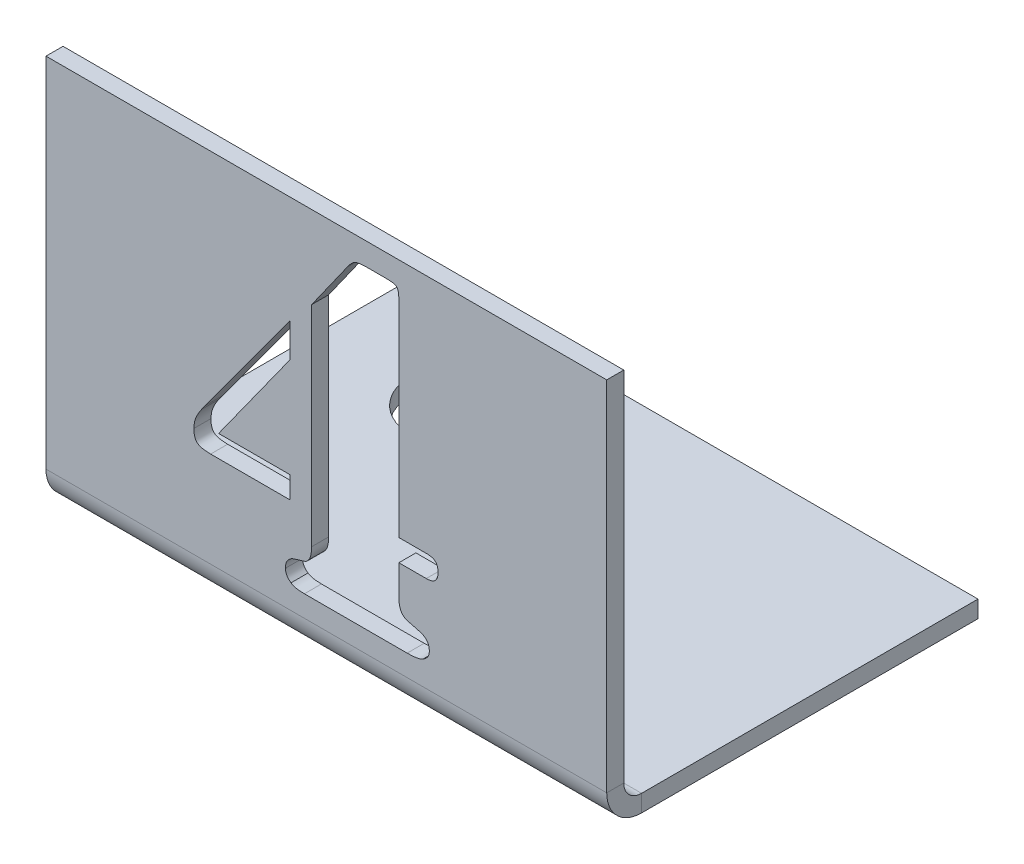
from build123d import *

# Parameters (mm, degrees)
SKETCH1_W            = 50
SKETCH1_H            = 30
BASE_FLANGE1_DEPTH   = 1.51892
EDGE_FLANGE1_DEPTH   = 50
M8_CLEARANCE_HOLE1_D = 9
CUT_EXTRUDE1_DEPTH   = 55.277389816


# Sheet-metal steps are written as plain solids
with BuildPart() as part:
    # Sketch1 → Base-Flange1 (new body)
    with BuildSketch(Plane(origin=(0, 0, 0), x_dir=(1, 0, 0), z_dir=(0, 1, 0))):
        with Locations((0, 15)):
            Rectangle(SKETCH1_W, SKETCH1_H)
    extrude(amount=BASE_FLANGE1_DEPTH)

    # Edge-Flange1 section (across the edge) → Edge-Flange1 (add)
    with BuildSketch(Plane(origin=(-25, 1.51892, 1.5875), x_dir=(0, 0, -1), z_dir=(1, 0, 0))):
        with BuildLine():
            Line((-1.51892, 1.5875), (-1.51892, 33.48108))
            Line((-1.51892, 33.48108), (0, 33.48108))
            Line((0, 33.48108), (0, 1.5875))
            ThreePointArc((0, 1.5875), (0.464967985, 0.464967985), (1.5875, 0))
            Line((1.5875, 0), (1.5875, -1.51892))
            ThreePointArc((1.5875, -1.51892), (-0.609070647, -0.609070647), (-1.51892, 1.5875))
        make_face()
    extrude(amount=EDGE_FLANGE1_DEPTH)

    # M8 Clearance Hole1 (through all)
    with Locations(Plane(origin=(0, 1.51892, 0), x_dir=(1, 0, 0), z_dir=(0, 1, 0))):
        with Locations((-13, 21.89358)):
            Hole(M8_CLEARANCE_HOLE1_D / 2)

    # Sketch11 → Cut-Extrude1 (cut, through all)
    with BuildSketch(Plane.XY.offset(3.10642)):
        with BuildLine():
            Line((-1.313983013, 27.652777778), (1.882197542, 32.167534722))
            add(Edge.make_bspline(
                [(1.882197542, 32.167534722), (1.942990154, 32.25422683), (2.055720733, 32.414984053), (2.238806296, 32.612748461), (2.402031604, 32.768107394), (2.575292151, 32.867707043), (2.775618459, 32.931720261), (3.025586613, 32.967610097), (3.337632557, 33.001581085), (3.567244353, 33.000559396), (3.692961431, 33)],
                knots=[0, 0, 0, 0, 1.195193305, 2.216302741, 3.043406804, 3.730660832, 4.454688059, 5.406997193, 6.580278791, 8, 8, 8, 8], degree=3))
            Line((3.692961431, 33), (5.467266987, 33))
            add(Edge.make_bspline(
                [(5.467266987, 33), (5.577064754, 32.996788141), (5.77366231, 32.991037172), (6.032013828, 32.946349792), (6.233785133, 32.868906911), (6.308685128, 32.770626919), (6.342266987, 32.7265625)],
                knots=[0, 0, 0, 0, 1.37922202, 2.469555487, 3.31381609, 4, 4, 4, 4], degree=3))
            add(Edge.make_bspline(
                [(6.342266987, 32.7265625), (6.362353673, 32.676444121), (6.407796446, 32.563059661), (6.435754197, 32.362580464), (6.463680714, 32.121762999), (6.46375452, 31.94690658), (6.463794764, 31.8515625)],
                knots=[0, 0, 0, 0, 0.726336959, 1.64321602, 2.714914776, 4, 4, 4, 4], degree=3))
            Line((6.463794764, 31.8515625), (6.463794764, 13.555555556))
            Line((6.463794764, 13.555555556), (9.028030875, 13.555555556))
            add(Edge.make_bspline(
                [(9.028030875, 13.555555556), (9.165896219, 13.546190847), (9.419639988, 13.528954925), (9.754751832, 13.344043), (9.938206738, 13.006772556), (9.954683864, 12.75366768), (9.963794764, 12.613715278)],
                knots=[0, 0, 0, 0, 1.088306732, 2.003049094, 2.895801301, 4, 4, 4, 4], degree=3))
            add(Edge.make_bspline(
                [(9.963794764, 12.613715278), (9.953871828, 12.46514926), (9.935630574, 12.192041557), (9.724439936, 11.830921806), (9.34752556, 11.633510395), (9.062693451, 11.619043932), (8.906503098, 11.611111111)],
                knots=[0, 0, 0, 0, 1.064523988, 1.9569058, 2.879650172, 4, 4, 4, 4], degree=3))
            Line((8.906503098, 11.611111111), (6.463794764, 11.611111111))
            Line((6.463794764, 11.611111111), (6.463794764, 8.955729167))
            add(Edge.make_bspline(
                [(6.463794764, 8.955729167), (6.465256175, 8.831576902), (6.468012829, 8.59738883), (6.54117183, 8.277019076), (6.627610008, 7.995757008), (6.738971671, 7.851550593), (6.791919764, 7.782986111)],
                knots=[0, 0, 0, 0, 1.194828702, 2.253802076, 3.169751524, 4, 4, 4, 4], degree=3))
            add(Edge.make_bspline(
                [(6.791919764, 7.782986111), (6.846531378, 7.730010442), (6.944813868, 7.634672101), (7.100203776, 7.539617352), (7.27176022, 7.495886787), (7.482006075, 7.440754455), (7.780922877, 7.369916119), (8.00732939, 7.311522722), (8.134801709, 7.278645833)],
                knots=[0, 0, 0, 0, 0.938335918, 1.688688255, 2.210658911, 3.11404715, 4.375139053, 6, 6, 6, 6], degree=3))
            add(Edge.make_bspline(
                [(8.134801709, 7.278645833), (8.292748806, 7.235768373), (8.582838073, 7.157018646), (8.93848225, 6.903617509), (9.154259726, 6.543911357), (9.175060001, 6.272945389), (9.186016987, 6.130208333)],
                knots=[0, 0, 0, 0, 1.146809638, 2.106256929, 3.002430776, 4, 4, 4, 4], degree=3))
            add(Edge.make_bspline(
                [(9.186016987, 6.130208333), (9.17899553, 6.042021554), (9.165241661, 5.869278259), (9.05359535, 5.623704764), (8.862916658, 5.414842755), (8.700602579, 5.306421387), (8.614836431, 5.249131944)],
                knots=[0, 0, 0, 0, 0.958462782, 1.877469862, 2.878463071, 4, 4, 4, 4], degree=3))
            add(Edge.make_bspline(
                [(8.614836431, 5.249131944), (8.534946889, 5.209690912), (8.357433658, 5.122053596), (8.034892473, 5.049887402), (7.643647807, 5.011727038), (7.359176572, 5.004119856), (7.205114209, 5)],
                knots=[0, 0, 0, 0, 0.737495844, 1.638703467, 2.721182046, 4, 4, 4, 4], degree=3))
            Line((7.205114209, 5), (6.482023931, 5))
            Line((6.482023931, 5), (-1.33221218, 5))
            Line((-1.33221218, 5), (-1.958080236, 5))
            add(Edge.make_bspline(
                [(-1.958080236, 5), (-2.089881071, 5.00416961), (-2.333985762, 5.01189203), (-2.66895246, 5.049646344), (-2.944215562, 5.122135251), (-3.089638978, 5.209698692), (-3.155128847, 5.249131944)],
                knots=[0, 0, 0, 0, 1.275972689, 2.363193818, 3.262881972, 4, 4, 4, 4], degree=3))
            add(Edge.make_bspline(
                [(-3.155128847, 5.249131944), (-3.228690112, 5.307025561), (-3.370553227, 5.418673569), (-3.534127754, 5.628370393), (-3.631583422, 5.871216423), (-3.641971775, 6.042227184), (-3.647316347, 6.130208333)],
                knots=[0, 0, 0, 0, 1.065580224, 2.054974559, 2.999328622, 4, 4, 4, 4], degree=3))
            add(Edge.make_bspline(
                [(-3.647316347, 6.130208333), (-3.640263565, 6.272706576), (-3.626998251, 6.540726201), (-3.433693624, 6.890936561), (-3.132521052, 7.155953313), (-2.874583156, 7.235736523), (-2.735858013, 7.278645833)],
                knots=[0, 0, 0, 0, 1.059227515, 1.99226149, 2.920190418, 4, 4, 4, 4], degree=3))
            add(Edge.make_bspline(
                [(-2.735858013, 7.278645833), (-2.628596603, 7.311344749), (-2.438567719, 7.36927554), (-2.186761633, 7.442084104), (-2.007968702, 7.494958163), (-1.85808029, 7.542989269), (-1.717703343, 7.629665553), (-1.64102438, 7.729186896), (-1.599573291, 7.782986111)],
                knots=[0, 0, 0, 0, 1.58908833, 2.815296579, 3.714312333, 4.231769587, 5.044130571, 6, 6, 6, 6], degree=3))
            add(Edge.make_bspline(
                [(-1.599573291, 7.782986111), (-1.553206662, 7.852049956), (-1.454388083, 7.999241828), (-1.378985552, 8.277685094), (-1.321790362, 8.598779226), (-1.316693685, 8.831797968), (-1.313983013, 8.955729167)],
                knots=[0, 0, 0, 0, 0.808960821, 1.724092502, 2.789556825, 4, 4, 4, 4], degree=3))
            Line((-1.313983013, 8.955729167), (-1.313983013, 27.652777778))
        make_face()
        with BuildLine():
            Line((-3.258427458, 25.404513889), (-3.258427458, 22.408854167))
            Line((-3.258427458, 22.408854167), (-9.608253847, 13.555555556))
            Line((-9.608253847, 13.555555556), (-3.258427458, 13.555555556))
            Line((-3.258427458, 13.555555556), (-3.258427458, 11.611111111))
            Line((-3.258427458, 11.611111111), (-10.319191347, 11.611111111))
            add(Edge.make_bspline(
                [(-10.319191347, 11.611111111), (-10.453058826, 11.614326043), (-10.697535464, 11.62019734), (-11.030466888, 11.667544917), (-11.298322213, 11.741534104), (-11.508093604, 11.857572638), (-11.651421931, 12.033101366), (-11.747915639, 12.255162092), (-11.806947017, 12.529695798), (-11.811530061, 12.730869026), (-11.813983013, 12.838541667)],
                knots=[0, 0, 0, 0, 1.411258846, 2.577323645, 3.536890269, 4.331839585, 5.059357258, 5.881395614, 6.866073128, 8, 8, 8, 8], degree=3))
            add(Edge.make_bspline(
                [(-11.813983013, 12.838541667), (-11.805252819, 12.985215395), (-11.787239389, 13.287854337), (-11.650289436, 13.74422143), (-11.429079802, 14.206722525), (-11.230633277, 14.501805138), (-11.127351069, 14.655381944)],
                knots=[0, 0, 0, 0, 0.891359058, 1.839183926, 2.875395504, 4, 4, 4, 4], degree=3))
            Line((-11.127351069, 14.655381944), (-10.823531625, 15.080729167))
            Line((-10.823531625, 15.080729167), (-3.258427458, 25.404513889))
        make_face()
    extrude(amount=-CUT_EXTRUDE1_DEPTH, mode=Mode.SUBTRACT)


solid = part.part
